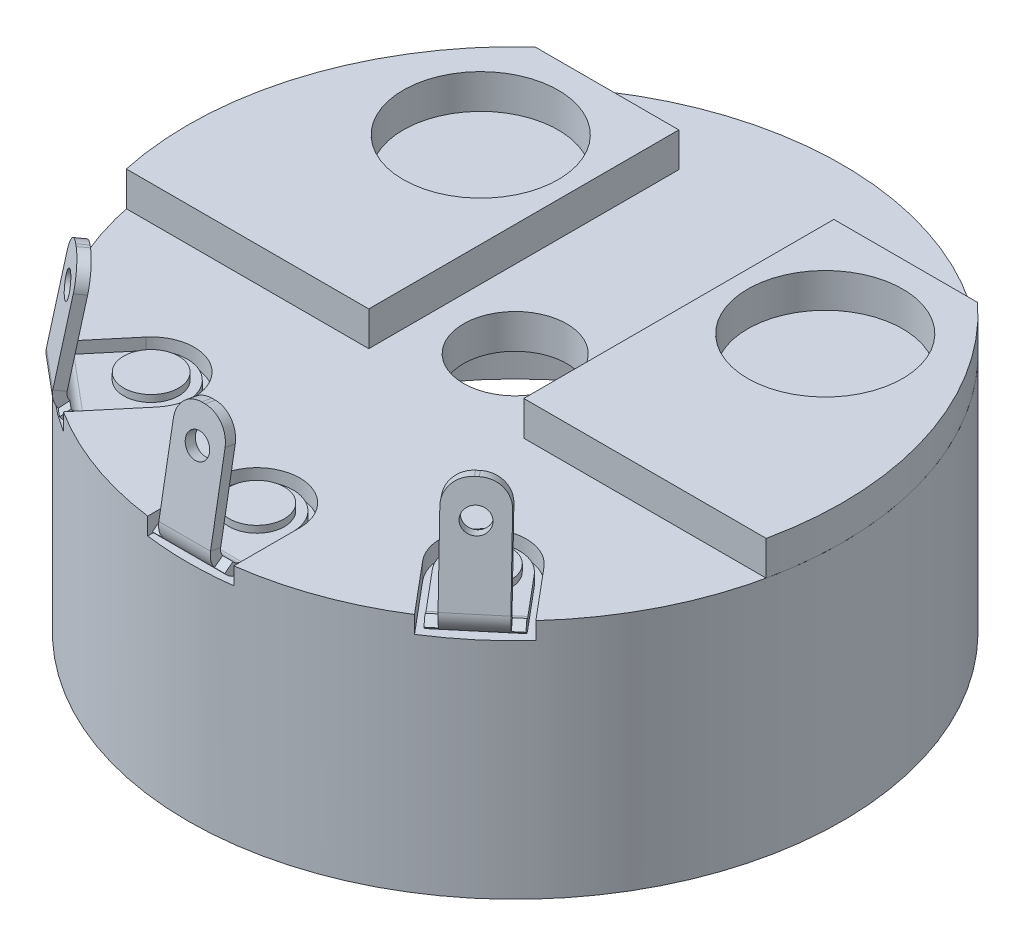
from build123d import *

# Parameters (mm, degrees)
SKETCH1_R                  = 4.75
SKETCH1_R_2                = 0.75
BOSS_EXTRUDE1_DEPTH        = 0.5
SKETCH1_3_R                = 1.125
BOSS_EXTRUDE2_DEPTH        = 0.5
BOSS_EXTRUDE2_2_DEPTH      = 0.5
SKETCH2_R                  = 0.375
CUT_EXTRUDE1_DEPTH         = 7.736096793
CUT_EXTRUDE2_DEPTH         = 0.25
CIRPATTERN1_COUNT          = 3
CIRPATTERN1_ANGLE          = 80
EXTRUDE_THIN2_START        = -0.5
SKETCH1_5_R                = 4.75
SKETCH1_5_R_2              = 4.5
EXTRUDE_THIN2_DEPTH        = 3
BASE_FLANGE1_START         = 0.15
SKETCH4_R                  = 0.175
SKETCH4_R_2                = 0.375
BASE_FLANGE1_DEPTH         = 0.15
SKETCHED_START             = -0.525
SKETCHED_BEND1_DEPTH       = 1.05
SKETCHED_BEND1_2_DEPTH     = 0.15
SKETCHED_START_2           = 0.375
SKETCHED_BEND1_3_DEPTH     = 0.15
SKETCHED_BEND1_4_DEPTH     = 1.05
SKETCHED_START_3           = -0.375
SKETCHED_BEND1_5_DEPTH     = 0.75
SKETCHED_START_4           = -4.741475404
SKETCHED_BEND1_6_OUTLINE_R = 0.175
SKETCHED_BEND1_6_DEPTH     = 0.149999999
SKETCH10_R                 = 0.375
BASE_FLANGE2_DEPTH         = 0.15
CIRPATTERN2_COUNT          = 3
CIRPATTERN2_ANGLE          = 80


with BuildPart() as part:
    # Sketch1 → Boss-Extrude1 (new body)
    with BuildSketch(Plane(origin=(0, 0, 0), x_dir=(1, 0, 0), z_dir=(0, 1, 0))):
        with Locations(Location((0, 0, 0), (0, 0, 270))):
            Circle(SKETCH1_R)
        with Locations(Location((0, 0, 0), (0, 0, 270))):
            Circle(SKETCH1_R_2, mode=Mode.SUBTRACT)
    extrude(amount=-BOSS_EXTRUDE1_DEPTH)

    # Sketch2 → Cut-Extrude1 (cut, through all)
    with BuildSketch(Plane(origin=(0, 0, 0), x_dir=(1, 0, 0), z_dir=(0, 1, 0))):
        with Locations(Location((-2.410453536, -2.872666662, 0), (0, 0, 270))):
            Circle(SKETCH2_R)
    cut_extrude1 = extrude(amount=-CUT_EXTRUDE1_DEPTH, mode=Mode.SUBTRACT)

    # Sketch2<4> → Cut-Extrude2 (cut)
    with BuildSketch(Plane(origin=(0, 0, 0), x_dir=(1, 0, 0), z_dir=(0, 1, 0))):
        with BuildLine():
            Line((-3.505473113, -3.205332784), (-2.889231313, -2.470924406))
            ThreePointArc((-2.889231313, -2.470924406), (-2.00871128, -2.393888885), (-1.931675759, -3.274408918))
            Line((-1.931675759, -3.274408918), (-2.547917559, -4.008817296))
            ThreePointArc((-2.547917559, -4.008817296), (-3.053241146, -3.638711105), (-3.505473113, -3.205332784))
        make_face()
    cut_extrude2 = extrude(amount=-CUT_EXTRUDE2_DEPTH, mode=Mode.SUBTRACT)

    # CirPattern1: Cut-Extrude1, Cut-Extrude2 ×3 about axis
    cirpattern1_axis = Axis((0, 0, 0), (0, 1, 0))
    add([cut_extrude1.rotate(cirpattern1_axis, i * CIRPATTERN1_ANGLE / (CIRPATTERN1_COUNT - 1)) for i in range(1, CIRPATTERN1_COUNT)], mode=Mode.SUBTRACT)
    add([cut_extrude2.rotate(cirpattern1_axis, i * CIRPATTERN1_ANGLE / (CIRPATTERN1_COUNT - 1)) for i in range(1, CIRPATTERN1_COUNT)], mode=Mode.SUBTRACT)

    # Sketch1<5> → Extrude-Thin2 (add)
    with BuildSketch(Plane(origin=(0, 0, 0), x_dir=(1, 0, 0), z_dir=(0, 1, 0)).offset(EXTRUDE_THIN2_START)):
        Circle(SKETCH1_5_R)
        Circle(SKETCH1_5_R_2, mode=Mode.SUBTRACT)
    extrude(amount=-EXTRUDE_THIN2_DEPTH)


with BuildPart() as body_2:
    # Sketch1<3> → Boss-Extrude2 (new body)
    with BuildSketch(Plane(origin=(0, 0, 0), x_dir=(1, 0, 0), z_dir=(0, 1, 0))):
        with BuildLine():
            ThreePointArc((4.75, 0), (4.348345299, 1.911646713), (3.211308145, 3.5))
            Line((3.211308145, 3.5), (1.125, 3.5))
            Line((1.125, 3.5), (1.125, -1))
            Line((1.125, -1), (4.643543905, -1))
            ThreePointArc((4.643543905, -1), (4.723310997, -0.502825243), (4.75, 0))
        make_face()
        with Locations(Location((2.5, 2, 0), (0, 0, 270))):
            Circle(SKETCH1_3_R, mode=Mode.SUBTRACT)
    extrude(amount=BOSS_EXTRUDE2_DEPTH)


with BuildPart() as body_3:
    # Sketch1<3> → Boss-Extrude2 2 (new body)
    with BuildSketch(Plane(origin=(0, 0, 0), x_dir=(1, 0, 0), z_dir=(0, 1, 0))):
        with BuildLine():
            Line((-1.125, 3.5), (-3.211308145, 3.5))
            ThreePointArc((-3.211308145, 3.5), (-4.526276083, 1.440598771), (-4.643543905, -1))
            Line((-4.643543905, -1), (-1.125, -1))
            Line((-1.125, -1), (-1.125, 3.5))
        make_face()
        with Locations(Location((-2.5, 2, 0), (0, 0, 270))):
            Circle(SKETCH1_3_R, mode=Mode.SUBTRACT)
    extrude(amount=BOSS_EXTRUDE2_2_DEPTH)


with BuildPart() as body_4:
    # Base-Flange1: sheet metal written as solids
    # Sketch4 → Base-Flange1 (new body)
    with BuildSketch(Plane(origin=(0, -0.25, 0), x_dir=(1, 0, 0), z_dir=(0, 1, 0)).offset(BASE_FLANGE1_START)):
        with BuildLine():
            Line((-3.428868668, -3.269611545), (-2.812626869, -2.535203167))
            ThreePointArc((-2.812626869, -2.535203167), (-2.072990041, -2.470493329), (-2.008280204, -3.210130157))
            Line((-2.008280204, -3.210130157), (-2.624522003, -3.944538535))
            Line((-2.624522003, -3.944538535), (-2.73942867, -3.848120394))
            Line((-2.73942867, -3.848120394), (-3.639331323, -4.920582614))
            ThreePointArc((-3.639331323, -4.920582614), (-3.876942368, -5.044275095), (-4.132422542, -4.963722506))
            Line((-4.132422542, -4.963722506), (-4.170724764, -4.931583125))
            ThreePointArc((-4.170724764, -4.931583125), (-4.294417245, -4.69397208), (-4.213864655, -4.438491907))
            Line((-4.213864655, -4.438491907), (-3.313962002, -3.366029686))
            Line((-3.313962002, -3.366029686), (-3.428868668, -3.269611545))
        make_face()
        with Locations(Location((-3.830179848, -4.564630594, 0), (0, 0, 270))):
            Circle(SKETCH4_R, mode=Mode.SUBTRACT)
        with Locations(Location((-2.410453536, -2.872666662, 0), (0, 0, 270))):
            Circle(SKETCH4_R_2, mode=Mode.SUBTRACT)
    extrude(amount=-BASE_FLANGE1_DEPTH)

    # Sketched Bend1: read off the stored shape, not the designer's step
    # Sketched Bend1 outline → Sketched Bend1 (cut)
    with BuildSketch(Plane(origin=(0, 0, 0), x_dir=(0.6427876096865547, 0, -0.7660444431189651), z_dir=(0.766044443118965, 0, 0.642787609686555)).offset(SKETCHED_START)):
        with BuildLine():
            Line((-4.760983594, -0.1), (-6.45870205, -0.1))
            Line((-6.45870205, -0.1), (-6.45870205, -0.25))
            Line((-6.45870205, -0.25), (-4.501175973, -0.25))
            ThreePointArc((-4.501175973, -0.25), (-4.651175973, -0.209807621), (-4.760983594, -0.1))
        make_face()
    extrude(amount=SKETCHED_BEND1_DEPTH, mode=Mode.SUBTRACT)

    # Sketched Bend1 2 outline → Sketched Bend1 2 (cut)
    with BuildSketch(Plane(origin=(0, 0, 0), x_dir=(0.6427876096865547, 0, -0.7660444431189651), z_dir=(0.766044443118965, 0, 0.642787609686555)).offset(SKETCHED_START)):
        Polygon((-4.70870205, -0.107257954), (-4.699124063, -0.1), (-4.70870205, -0.1), align=None)
    extrude(amount=SKETCHED_BEND1_2_DEPTH, mode=Mode.SUBTRACT)

    # Sketched Bend1 3 outline → Sketched Bend1 3 (cut)
    with BuildSketch(Plane(origin=(0, 0, 0), x_dir=(0.6427876096865547, 0, -0.7660444431189651), z_dir=(0.766044443118965, 0, 0.642787609686555)).offset(SKETCHED_START_2)):
        Polygon((-4.70870205, -0.107257954), (-4.699124063, -0.1), (-4.70870205, -0.1), align=None)
    extrude(amount=SKETCHED_BEND1_3_DEPTH, mode=Mode.SUBTRACT)

    # Sketched Bend1 4 outline → Sketched Bend1 4 (add)
    with BuildSketch(Plane(origin=(0, 0, 0), x_dir=(0.6427876096865547, 0, -0.7660444431189651), z_dir=(0.766044443118965, 0, 0.642787609686555)).offset(SKETCHED_START)):
        with BuildLine():
            ThreePointArc((-4.501175973, -0.1), (-4.567925274, -0.084329932), (-4.620728362, -0.040593743))
            Line((-4.620728362, -0.040593743), (-4.699124063, -0.1))
            Line((-4.699124063, -0.1), (-4.501175973, -0.1))
        make_face()
        with BuildLine():
            Line((-4.70870205, -0.166640087), (-4.70870205, -0.107257954))
            Line((-4.70870205, -0.107257954), (-4.740280751, -0.131187486))
            ThreePointArc((-4.740280751, -0.131187486), (-4.725193834, -0.149539465), (-4.70870205, -0.166640087))
        make_face()
    extrude(amount=SKETCHED_BEND1_4_DEPTH)

    # Sketched Bend1 5 outline → Sketched Bend1 5 (add)
    with BuildSketch(Plane(origin=(0, 0, 0), x_dir=(0.6427876096865547, 0, -0.7660444431189651), z_dir=(0.766044443118965, 0, 0.642787609686555)).offset(SKETCHED_START_3)):
        with BuildLine():
            ThreePointArc((-4.620728362, -0.040593743), (-4.646984295, 0.014787316), (-4.648897136, 0.076047227))
            Line((-4.648897136, 0.076047227), (-4.377167779, 1.617100985))
            Line((-4.377167779, 1.617100985), (-4.524888942, 1.643148211))
            Line((-4.524888942, 1.643148211), (-4.796618299, 0.102094453))
            ThreePointArc((-4.796618299, 0.102094453), (-4.796618299, -0.002094454), (-4.760983594, -0.1))
            Line((-4.760983594, -0.1), (-4.699124063, -0.1))
            Line((-4.699124063, -0.1), (-4.620728362, -0.040593743))
        make_face()
    extrude(amount=SKETCHED_BEND1_5_DEPTH)

    # Sketched Bend1 6 outline → Sketched Bend1 6 (cut)
    with BuildSketch(Plane(origin=(0, 0, 0), x_dir=(0.7741336234861974, 0.1419950663058133, 0.6168910228986462), z_dir=(0.6330222215595044, -0.17364817766693408, -0.7544065067354754)).offset(SKETCHED_START_4)):
        with BuildLine():
            Line((-0.251054745, -0.877817458), (0.095287988, -0.827352508))
            ThreePointArc((0.095287988, -0.827352508), (-0.164394149, -0.761595178), (-0.301519694, -0.531474724))
            Line((-0.301519694, -0.531474724), (-0.251054745, -0.877817458))
        make_face()
        with BuildLine():
            ThreePointArc((0.440643306, -0.423335547), (0.374885975, -0.683017684), (0.144765522, -0.82014323))
            Line((0.144765522, -0.82014323), (0.491108255, -0.769678281))
            Line((0.491108255, -0.769678281), (0.440643306, -0.423335547))
        make_face()
        with Locations((0.04793397, -0.328972536)):
            Circle(SKETCHED_BEND1_6_OUTLINE_R)
    extrude(amount=SKETCHED_BEND1_6_DEPTH, mode=Mode.SUBTRACT)


with BuildPart() as body_5:
    # Base-Flange2: sheet metal written as solids
    # Sketch10 → Base-Flange2 (new body)
    with BuildSketch(Plane.XZ.offset(0.5)):
        with BuildLine():
            ThreePointArc((-2.828265483, 3.37059555), (0, -4.4), (2.828265483, 3.37059555))
            ThreePointArc((2.828265483, 3.37059555), (1.912524648, 3.290478608), (1.99264159, 2.374737774))
            ThreePointArc((1.99264159, 2.374737774), (0, -3.1), (-1.99264159, 2.374737774))
            ThreePointArc((-1.99264159, 2.374737774), (-1.912524648, 3.290478608), (-2.828265483, 3.37059555))
        make_face()
        with Locations(Location((2.410453536, 2.872666662, 0), (0, 0, 270))):
            Circle(SKETCH10_R, mode=Mode.SUBTRACT)
        with Locations(Location((-2.410453536, 2.872666662, 0), (0, 0, 270))):
            Circle(SKETCH10_R, mode=Mode.SUBTRACT)
    extrude(amount=BASE_FLANGE2_DEPTH)


with BuildPart() as body_6:
    # Sketch13 → Revolve1 (revolve)
    with BuildSketch(Plane(origin=(0, 0, 0), x_dir=(-0.6427876096865403, 0, 0.7660444431189773), z_dir=(-0.7660444431189773, 0, -0.6427876096865403)), mode=Mode.PRIVATE) as revolve1_sk:
        Polygon((3.374922202, -0.104424067), (3.349922202, -0.104424067), (3.349922202, 0), (3.749922202, 0), (3.749922202, -0.75779552), (3.349922202, -0.75779552), (3.349922202, -0.653371453), (3.374922202, -0.653371453), align=None)
    revolve(revolve1_sk.sketch.rotate(Axis((-2.410403529, 0, 2.872607065), (0, -1, 0)), 140), axis=Axis((-2.410403529, 0, 2.872607065), (0, -1, 0)))


with BuildPart() as cirpattern2_1:
    # CirPattern2: pattern copy
    add(body_6.part.rotate(Axis((0, 0, 0), (0, 1, 0)), 1 * CIRPATTERN2_ANGLE / (CIRPATTERN2_COUNT - 1)))


with BuildPart() as cirpattern2_2:
    # CirPattern2: pattern copy
    add(body_6.part.rotate(Axis((0, 0, 0), (0, 1, 0)), 2 * CIRPATTERN2_ANGLE / (CIRPATTERN2_COUNT - 1)))


with BuildPart() as cirpattern2_3:
    # CirPattern2: pattern copy
    add(body_4.part.rotate(Axis((0, 0, 0), (0, 1, 0)), 1 * CIRPATTERN2_ANGLE / (CIRPATTERN2_COUNT - 1)))


with BuildPart() as cirpattern2_4:
    # CirPattern2: pattern copy
    add(body_4.part.rotate(Axis((0, 0, 0), (0, 1, 0)), 2 * CIRPATTERN2_ANGLE / (CIRPATTERN2_COUNT - 1)))


solid = Compound([part.part, body_2.part, body_3.part, body_4.part, body_5.part, body_6.part, cirpattern2_1.part, cirpattern2_2.part, cirpattern2_3.part, cirpattern2_4.part])
